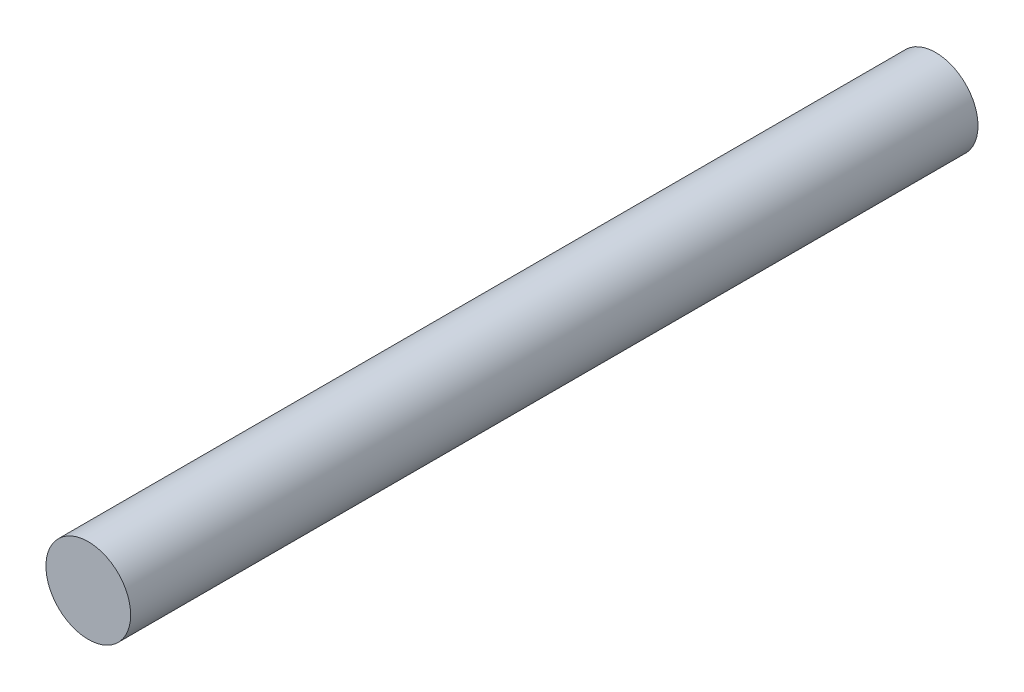
from build123d import *

# Parameters (mm, degrees)
SKETCH1_R           = 6.35
BOSS_EXTRUDE1_DEPTH = 127


with BuildPart() as part:
    # Sketch1 → Boss-Extrude1 (new body)
    with BuildSketch(Plane.XY):
        Circle(SKETCH1_R)
    extrude(amount=BOSS_EXTRUDE1_DEPTH)


solid = part.part
